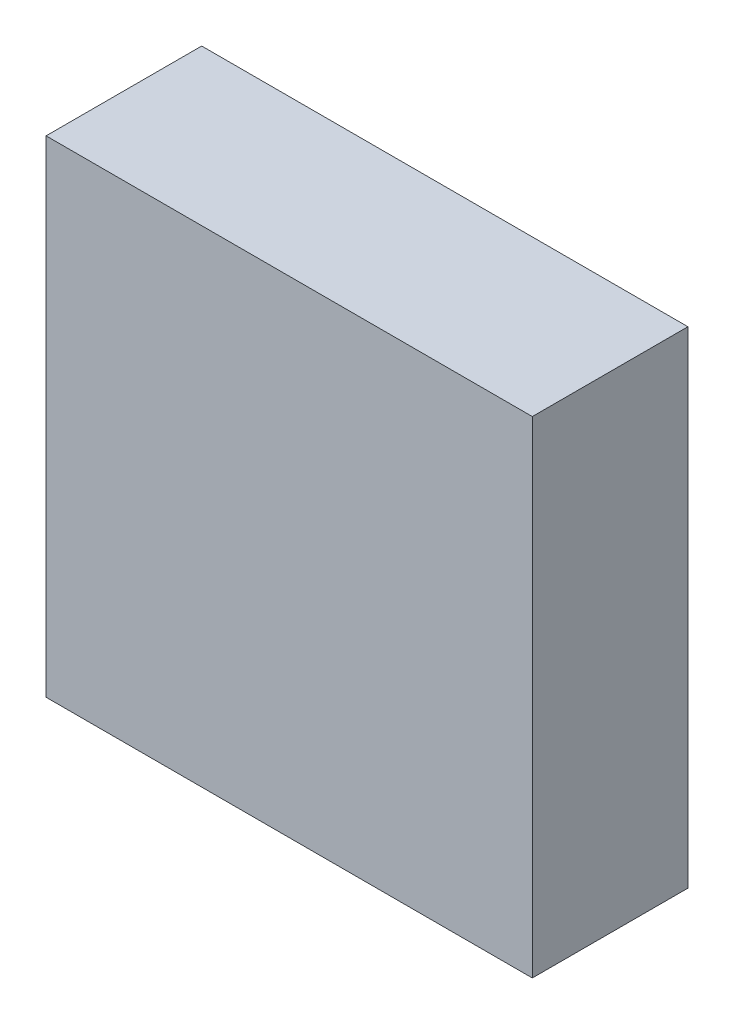
from build123d import *

# Parameters (mm, degrees)
SKETCH1_W           = 250
SKETCH1_H           = 250
BOSS_EXTRUDE1_DEPTH = 80


with BuildPart() as part:
    # Sketch1 → Boss-Extrude1 (new body)
    with BuildSketch(Plane.XY):
        with Locations((125, 125)):
            Rectangle(SKETCH1_W, SKETCH1_H)
    extrude(amount=BOSS_EXTRUDE1_DEPTH)


solid = part.part
